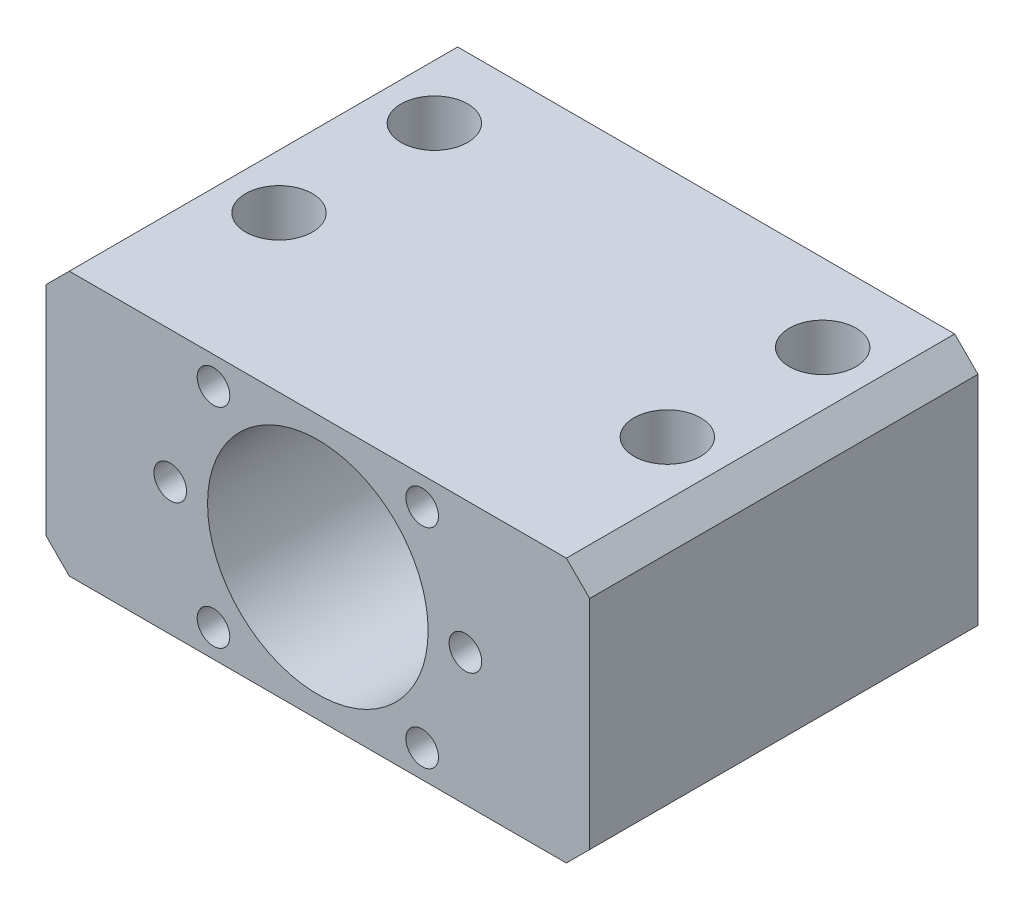
from build123d import *

# Parameters (mm, degrees)
SKETCH1_W                               = 70
SKETCH1_H                               = 50
BOSS_EXTRUDE1_DEPTH                     = 48
CBORE_FOR_M8_HEX_HEAD_BOLT1_D           = 8.6
CBORE_FOR_M8_HEX_HEAD_BOLT1_CBORE_D     = 14
CBORE_FOR_M8_HEX_HEAD_BOLT1_CBORE_DEPTH = 11
M25_CLEARANCE_HOLE1_D                   = 28.4
F_4_2_4_2_DIAMETER_HOLE1_D              = 4.2
F_4_2_4_2_DIAMETER_HOLE1_DEPTH          = 14
F_4_2_4_2_DIAMETER_HOLE1_TIP            = 1.2618073
SKETCH8_W                               = 70
SKETCH8_H                               = 7
CUT_EXTRUDE1_DEPTH                      = 66.582009728
CHAMFER1_SIZE                           = 3


with BuildPart() as part:
    # Sketch1 → Boss-Extrude1 (new body)
    with BuildSketch(Plane.XZ.offset(24)):
        Rectangle(SKETCH1_W, SKETCH1_H)
    extrude(amount=-BOSS_EXTRUDE1_DEPTH)

    # CBORE for M8 Hex Head Bolt1 (through all)
    with Locations(Plane(origin=(0, -24, 0), x_dir=(-1, 0, 0), z_dir=(0, -1, 0))):
        with Locations((25, -5), (-25, -5), (-25, 15), (25, 15)):
            CounterBoreHole(CBORE_FOR_M8_HEX_HEAD_BOLT1_D / 2, CBORE_FOR_M8_HEX_HEAD_BOLT1_CBORE_D / 2, CBORE_FOR_M8_HEX_HEAD_BOLT1_CBORE_DEPTH)

    # M25 Clearance Hole1 (through all)
    with Locations(Plane(origin=(0, 0, -25), x_dir=(-1, 0, 0), z_dir=(0, 0, -1))):
        with Locations((0, 0)):
            Hole(M25_CLEARANCE_HOLE1_D / 2)

    # Ø4.2 (4.2) Diameter Hole1
    with Locations(Plane.XY.offset(25)):
        with Locations((13.435028843, -13.435028843), (13.435028843, 13.435028843), (19, 0), (-13.435028843, 13.435028843), (-13.435028843, -13.435028843), (-19, 0)):
            Hole(F_4_2_4_2_DIAMETER_HOLE1_D / 2, depth=F_4_2_4_2_DIAMETER_HOLE1_DEPTH)
            with Locations((0, 0, -(F_4_2_4_2_DIAMETER_HOLE1_DEPTH + F_4_2_4_2_DIAMETER_HOLE1_TIP / 2))):  # 118° drill point
                Cone(0, F_4_2_4_2_DIAMETER_HOLE1_D / 2, F_4_2_4_2_DIAMETER_HOLE1_TIP, mode=Mode.SUBTRACT)

    # Sketch8 → Cut-Extrude1 (cut, through all)
    with BuildSketch(Plane.XY.offset(25)):
        with Locations((0, 20.5)):
            Rectangle(SKETCH8_W, SKETCH8_H)
        with Locations((0, -20.5)):
            Rectangle(SKETCH8_W, SKETCH8_H)
    extrude(amount=-CUT_EXTRUDE1_DEPTH, mode=Mode.SUBTRACT)

    # Chamfer1
    chamfer1_edges = [part.edges().sort_by_distance(p)[0] for p in [
        (-35, -17, 0),
        (35, -17, 0),
        (35, 17, 0),
        (-35, 17, 0),
    ]]
    chamfer(chamfer1_edges, length=CHAMFER1_SIZE - 0.0001)  # a hair under: the kernel refuses the full size


solid = part.part
